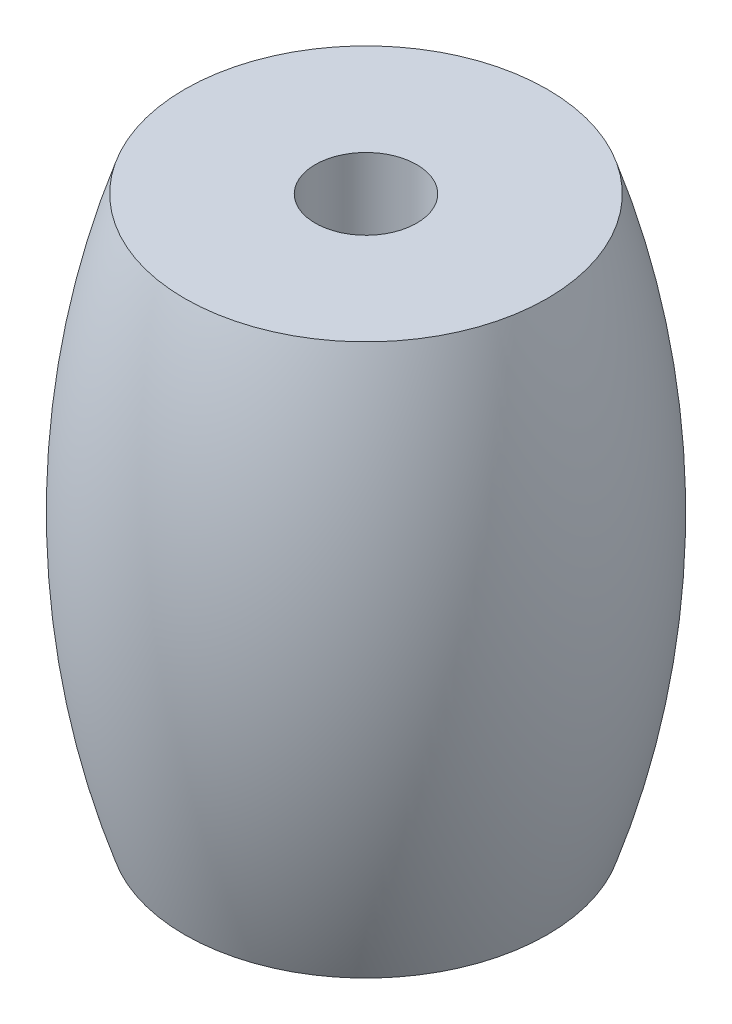
from build123d import *


with BuildPart() as part:
    # 草图1 → 旋转1 (revolve)
    with BuildSketch(Plane.XY):
        with BuildLine():
            Line((-1.75, 16.564395321), (-1.75, -2.435604679))
            Line((-1.75, -2.435604679), (-6.25, -2.435604679))
            ThreePointArc((-6.25, -2.435604679), (-7.79389345, 7.064395321), (-6.25, 16.564395321))
            Line((-6.25, 16.564395321), (-1.75, 16.564395321))
        make_face()
    revolve(axis=Axis((0, 0, 0), (0, 1, 0)))


solid = part.part
